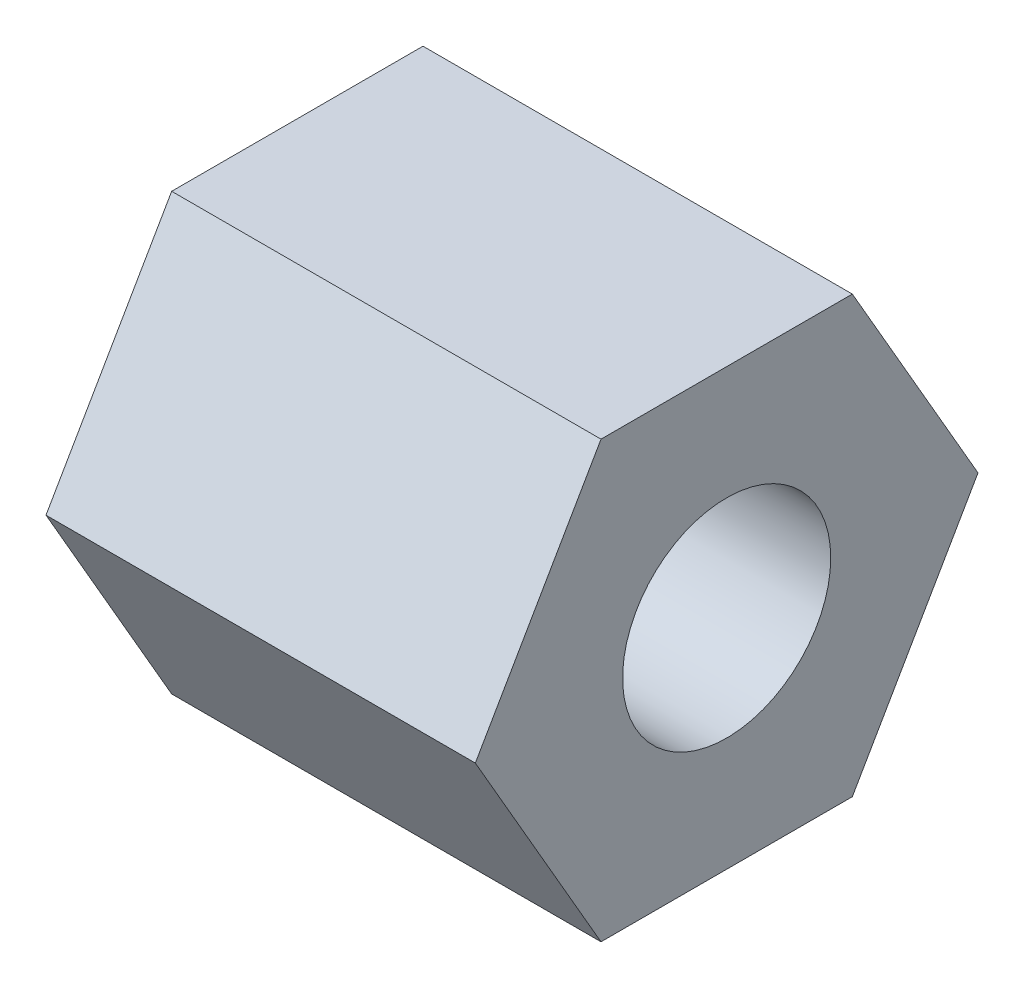
from build123d import *

# Parameters (mm, degrees)
BOSS_EXTRUDE1_DEPTH   = 5.03
F_2_CLEARANCE_HOLE1_D = 2.4384


with BuildPart() as part:
    # Sketch1 → Boss-Extrude1 (new body)
    with BuildSketch(Plane(origin=(0, 0, 0), x_dir=(0, 0, -1), z_dir=(1, 0, 0))):
        Polygon((2.944486373, 0), (1.472243186, 2.55), (-1.472243186, 2.55), (-2.944486373, 0), (-1.472243186, -2.55), (1.472243186, -2.55), align=None)
    extrude(amount=BOSS_EXTRUDE1_DEPTH)

    # #2 Clearance Hole1 (through all)
    with Locations(Plane(origin=(5.03, 0, 0), x_dir=(0, 0, -1), z_dir=(1, 0, 0))):
        with Locations((0, 0)):
            Hole(F_2_CLEARANCE_HOLE1_D / 2)


solid = part.part
